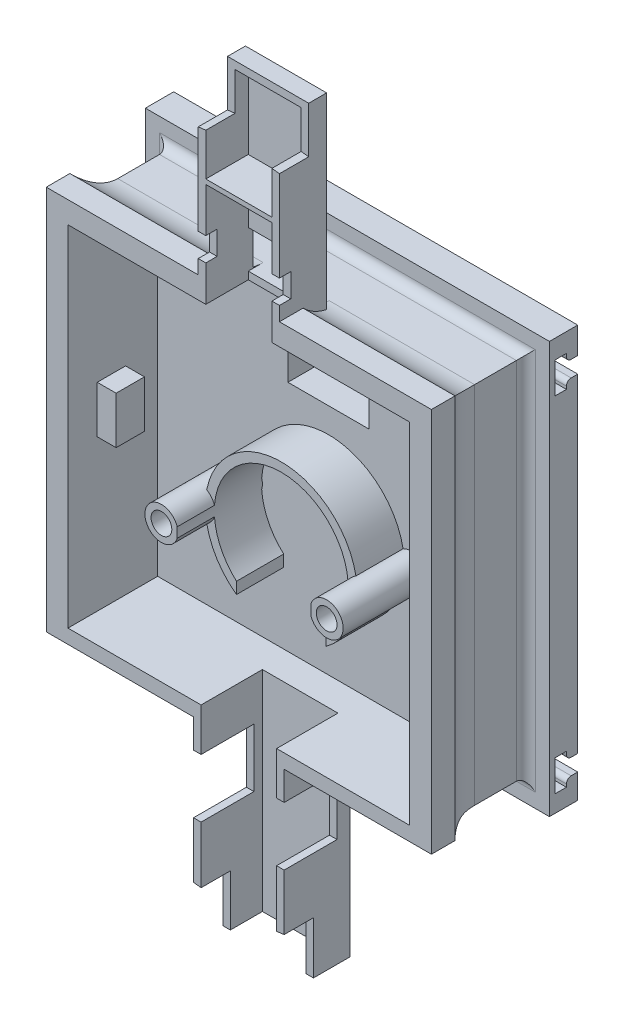
from build123d import *
from OCP.BRepAlgoAPI import BRepAlgoAPI_Cut
from OCP.TopTools import TopTools_ListOfShape
from build123d.topology import SkipClean

# Parameters (mm, degrees)
BOSS_EXTRUDE2_DEPTH      = 23
BOSS_EXTRUDE2_2_DEPTH    = 23
BOSS_EXTRUDE2_3_DEPTH    = 23
BOSS_EXTRUDE2_4_DEPTH    = 23
SKETCH2_W                = 72.4
SKETCH2_H                = 1
BOSS_EXTRUDE3_DEPTH      = 77.2
SKETCH1_5_W              = 14
SKETCH1_5_H              = 1.6
BOSS_EXTRUDE4_DEPTH      = 10
BOSS_EXTRUDE5_DEPTH      = 5
SKETCH5_W                = 1.6
SKETCH5_H                = 41.6
BOSS_EXTRUDE6_DEPTH      = 1
SKETCH5_5_W              = 1.6
SKETCH5_5_H              = 41.6
BOSS_EXTRUDE7_DEPTH      = 10
SKETCH6_W                = 17.2
SKETCH6_H                = 1
BOSS_EXTRUDE8_DEPTH      = 39
SKETCH7_W                = 17.2
SKETCH7_H                = 1.6
BOSS_EXTRUDE9_DEPTH      = 13
BOSS_EXTRUDE10_DEPTH     = 10
BOSS_EXTRUDE11_DEPTH     = 42.8
SKETCH1_12_W             = 1.6
SKETCH1_12_H             = 10
BOSS_EXTRUDE18_DEPTH     = 23
SKETCH10_W               = 72.4
SKETCH10_H               = 74
SKETCH10_R               = 3.5
BOSS_EXTRUDE14_DEPTH     = 3
BOSS_EXTRUDE15_DEPTH     = 13
SKETCH1_11_W             = 1.6
SKETCH1_11_H             = 10
BOSS_EXTRUDE17_DEPTH     = 23
FILLET1_START            = -1.6
FILLET1_DEPTH            = 29.2
FILLET1_START_2          = 44.8
FILLET1_2_DEPTH          = 29.2
FILLET1_START_3          = 26.6
FILLET1_3_DEPTH          = 2.6
FILLET1_START_4          = 43.2
FILLET1_4_DEPTH          = 2.6
FILLET1_START_5          = -2.995710024
FILLET1_5_DEPTH          = 81.600000768
FILLET1_START_6          = 74
FILLET1_6_DEPTH          = 4
FILLET1_START_7          = -6
FILLET1_7_DEPTH          = 4.4
SKICA1_W                 = 85.6
SKICA1_H                 = 87.2
P_IDAT_VYSUNUT_M1_DEPTH  = 6
ZAOBLIT1_R               = 2
ODEBRAT_VYSUNUT_M1_DEPTH = 90
ZAOBLIT2_R               = 1
SKICA3_W                 = 17.2
SKICA3_H                 = 17.2
ODEBRAT_VYSUNUT_M2_DEPTH = 90
SKETCH13_W               = 17.2
SKETCH13_H               = 3
CUT_EXTRUDE1_DEPTH       = 10
SKETCH14_W               = 14
SKETCH14_H               = 4
BOSS_EXTRUDE19_DEPTH     = 1.6
SKETCH16_W               = 8
SKETCH16_H               = 8
CUT_EXTRUDE3_DEPTH       = 1
SKETCH16_3_W             = 14
SKETCH16_3_H             = 1
BOSS_EXTRUDE20_DEPTH     = 9
SKETCH17_W               = 11.2
SKETCH17_H               = 12.4
CUT_EXTRUDE4_DEPTH       = 200
SKETCH18_R               = 85.15
SKETCH18_R_2             = 70.15
CUT_EXTRUDE5_DEPTH       = 6.2
BOSS_EXTRUDE25_OUTLINE_R = 2.2
BOSS_EXTRUDE25_DEPTH     = 20.9
SKETCH28_W               = 6
SKETCH28_H               = 10
BOSS_EXTRUDE28_DEPTH     = 4
SKETCH31_W               = 6
SKETCH31_H               = 10
BOSS_EXTRUDE29_DEPTH     = 4
CUT_EXTRUDE6_START       = -5
SKETCH10_14_R            = 2.2
CUT_EXTRUDE6_DEPTH       = 5
SKETCH38_W               = 17.2
SKETCH38_H               = 5
CUT_EXTRUDE7_DEPTH       = 2.4


with BuildPart() as part:
    # Sketch1 → Boss-Extrude2 (new body)
    with BuildSketch(Plane.XY):
        Polygon((28.2, 0), (0, 0), (0, 32), (-1.6, 32), (-1.6, -1.6), (28.2, -1.6), align=None)
    extrude(amount=BOSS_EXTRUDE2_DEPTH)



with BuildPart() as body_2:
    # Sketch1 → Boss-Extrude2 2 (new body)
    with BuildSketch(Plane.XY):
        Polygon((-1.6, 42), (0, 42), (0, 74), (29.2, 74), (29.2, 75.6), (-1.6, 75.6), align=None)
    extrude(amount=BOSS_EXTRUDE2_2_DEPTH)


with BuildPart() as body_3:
    # Sketch1 → Boss-Extrude2 3 (new body)
    with BuildSketch(Plane.XY):
        Polygon((72.4, 0), (44.2, 0), (44.2, -1.6), (74, -1.6), (74, 32), (72.4, 32), align=None)
    extrude(amount=BOSS_EXTRUDE2_3_DEPTH)


with BuildPart() as body_4:
    # Sketch1 → Boss-Extrude2 4 (new body)
    with BuildSketch(Plane.XY):
        Polygon((43.2, 75.6), (43.2, 74), (72.4, 74), (72.4, 42), (74, 42), (74, 75.6), align=None)
    extrude(amount=BOSS_EXTRUDE2_4_DEPTH)


with BuildPart() as part_1:
    add(part.part)

    add(body_2.part)  # Boss-Extrude3 merges body 2

    add(body_3.part)  # Boss-Extrude3 merges body 3

    add(body_4.part)  # Boss-Extrude3 merges body 4
    # Sketch2 → Boss-Extrude3 (add)
    with BuildSketch(Plane(origin=(0, -1.6, 0), x_dir=(1, 0, 0), z_dir=(0, 1, 0))):
        with Locations((36.2, -0.5)):
            Rectangle(SKETCH2_W, SKETCH2_H)
    extrude(amount=BOSS_EXTRUDE3_DEPTH)

    # Sketch1<5> → Boss-Extrude4 (add)
    with BuildSketch(Plane.XY):
        with Locations((36.2, 74.8)):
            Rectangle(SKETCH1_5_W, SKETCH1_5_H)
        with Locations((36.2, 74.8)):
            Rectangle(SKETCH1_5_W, SKETCH1_5_H)
    extrude(amount=BOSS_EXTRUDE4_DEPTH)

    # Sketch4 → Boss-Extrude5 (add)
    with BuildSketch(Plane.XY.offset(23)):
        Polygon((29.2, 78.604290744), (-4.6, 78.604290744), (-4.6, -2.995709256), (28.2, -2.995709256), (28.2, -1.6), (-1.6, -1.6), (-1.6, 75.6), (29.2, 75.6), align=None)
        Polygon((77, 78.604290744), (43.2, 78.604290744), (43.2, 75.6), (74, 75.6), (74, -1.6), (44.197854628, -1.6), (44.197854628, -2.995709256), (77, -2.995709256), align=None)
    extrude(amount=-BOSS_EXTRUDE5_DEPTH)

    # Sketch5 → Boss-Extrude6 (add)
    with BuildSketch(Plane.XY.offset(23)):
        with Locations((44, 94.8)):
            Rectangle(SKETCH5_W, SKETCH5_H)
        with Locations((28.4, 94.8)):
            Rectangle(SKETCH5_W, SKETCH5_H)
    extrude(amount=-BOSS_EXTRUDE6_DEPTH)

    # Sketch5<5> → Boss-Extrude7 (add)
    with BuildSketch(Plane.XY.offset(23)):
        with Locations((44, 94.8)):
            Rectangle(SKETCH5_5_W, SKETCH5_5_H)
        with Locations((28.4, 94.8)):
            Rectangle(SKETCH5_5_W, SKETCH5_5_H)
    extrude(amount=-BOSS_EXTRUDE7_DEPTH)

    # Sketch6 → Boss-Extrude8 (add)
    with BuildSketch(Plane(origin=(0, 75.6, 0), x_dir=(1, 0, 0), z_dir=(0, 1, 0))):
        with Locations((36.2, -13.5)):
            Rectangle(SKETCH6_W, SKETCH6_H)
    extrude(amount=BOSS_EXTRUDE8_DEPTH)

    # Sketch7 → Boss-Extrude9 (add)
    with BuildSketch(Plane.XY.offset(10)):
        with Locations((36.2, 114.8)):
            Rectangle(SKETCH7_W, SKETCH7_H)
    extrude(amount=BOSS_EXTRUDE9_DEPTH)

    # Sketch1<9> → Boss-Extrude10 (add)
    with BuildSketch(Plane.XY):
        Polygon((36.201957308, 0), (28.2, 0), (28.2, -1.6), (36.201276505, -1.6), align=None)
        Polygon((44.2, 0), (36.201957308, 0), (36.201276505, -1.6), (44.2, -1.6), align=None)
    extrude(amount=BOSS_EXTRUDE10_DEPTH)

    # Sketch8 → Boss-Extrude11 (add)
    with BuildSketch(Plane.XZ.offset(1.6)):
        Polygon((28.2, 23), (26.6, 23), (26.6, 9.1), (45.8, 9.1), (45.8, 23), (44.2, 23), (44.2, 10), (28.2, 10), align=None)
    extrude(amount=BOSS_EXTRUDE11_DEPTH)

    # Sketch1<12> → Boss-Extrude18 (add)
    with BuildSketch(Plane.XY):
        Polygon((-1.6, 32), (0, 32), (0, 42), (-0.266113958, 42), (-1.6, 42), align=None)
        with Locations((73.2, 37)):
            Rectangle(SKETCH1_12_W, SKETCH1_12_H)
    extrude(amount=BOSS_EXTRUDE18_DEPTH)

    # Sketch10 → Boss-Extrude14 (add)
    with BuildSketch(Plane.XY.offset(1)):
        with Locations((36.2, 37)):
            Rectangle(SKETCH10_W, SKETCH10_H)
        with BuildLine():
            Line((46.6, 15.70975997), (46.6, 18.331494428))
            ThreePointArc((46.6, 18.331494428), (49.214724455, 22.320480006), (50.361142857, 26.950222414))
            ThreePointArc((50.361142857, 26.950222414), (56.410242637, 30.214629731), (52.006, 24.937262009))
            ThreePointArc((52.006, 24.937262009), (50.091555257, 19.861530087), (46.6, 15.70975997))
        make_face(mode=Mode.SUBTRACT)
        with Locations(Location((18.7, 28, 0), (0, 0, 180))):
            Circle(SKETCH10_R, mode=Mode.SUBTRACT)
    extrude(amount=BOSS_EXTRUDE14_DEPTH)

    # Sketch10<5> → Boss-Extrude15 (add)
    with BuildSketch(Plane.XY.offset(1)):
        with BuildLine():
            ThreePointArc((52.006, 31.062737991), (36.2, 44.1), (20.394, 31.062737991))
            ThreePointArc((20.394, 31.062737991), (21.410242637, 30.214629731), (22.038857143, 29.049777586))
            ThreePointArc((22.038857143, 29.049777586), (36.2, 42.2), (50.361142857, 29.049777586))
            ThreePointArc((50.361142857, 29.049777586), (50.989757363, 30.214629731), (52.006, 31.062737991))
        make_face()
        with BuildLine():
            ThreePointArc((20.394, 24.937262009), (22.308444743, 19.861530087), (25.8, 15.70975997))
            Line((25.8, 15.70975997), (25.8, 18.331494428))
            ThreePointArc((25.8, 18.331494428), (23.185275545, 22.320480006), (22.038857143, 26.950222414))
            ThreePointArc((22.038857143, 26.950222414), (21.410242637, 25.785370269), (20.394, 24.937262009))
        make_face()
        with BuildLine():
            Line((46.6, 18.331494428), (46.6, 15.70975997))
            ThreePointArc((46.6, 15.70975997), (50.091555257, 19.861530087), (52.006, 24.937262009))
            ThreePointArc((52.006, 24.937262009), (50.989757363, 25.785370269), (50.361142857, 26.950222414))
            ThreePointArc((50.361142857, 26.950222414), (49.214724455, 22.320480006), (46.6, 18.331494428))
        make_face()
        with BuildLine():
            ThreePointArc((25.8, 15.70975997), (26.243700768, 15.347644267), (26.7, 15.001538553))
            Line((26.7, 15.001538553), (26.7, 17.445853895))
            ThreePointArc((26.7, 17.445853895), (26.240151116, 17.878665591), (25.8, 18.331494428))
            Line((25.8, 18.331494428), (25.8, 15.70975997))
        make_face()
        with BuildLine():
            Line((45.7, 17.445853895), (45.7, 15.001538553))
            ThreePointArc((45.7, 15.001538553), (46.156299232, 15.347644267), (46.6, 15.70975997))
            Line((46.6, 15.70975997), (46.6, 18.331494428))
            ThreePointArc((46.6, 18.331494428), (46.159848884, 17.878665591), (45.7, 17.445853895))
        make_face()
        with BuildLine():
            ThreePointArc((20.182285714, 26.374321969), (20.27192783, 25.653403117), (20.394, 24.937262009))
            ThreePointArc((20.394, 24.937262009), (21.410242637, 25.785370269), (22.038857143, 26.950222414))
            ThreePointArc((22.038857143, 26.950222414), (22, 28), (22.038857143, 29.049777586))
            ThreePointArc((22.038857143, 29.049777586), (21.410242637, 30.214629731), (20.394, 31.062737991))
            ThreePointArc((20.394, 31.062737991), (20.27192783, 30.346596883), (20.182285714, 29.625678031))
            ThreePointArc((20.182285714, 29.625678031), (20.712588951, 28.888530086), (20.9, 28))
            ThreePointArc((20.9, 28), (20.712588951, 27.111469914), (20.182285714, 26.374321969))
        make_face()
        with BuildLine():
            ThreePointArc((50.361142857, 26.950222414), (50.989757363, 25.785370269), (52.006, 24.937262009))
            ThreePointArc((52.006, 24.937262009), (52.12807217, 25.653403117), (52.217714286, 26.374321969))
            ThreePointArc((52.217714286, 26.374321969), (51.5, 28), (52.217714286, 29.625678031))
            ThreePointArc((52.217714286, 29.625678031), (52.12807217, 30.346596883), (52.006, 31.062737991))
            ThreePointArc((52.006, 31.062737991), (50.989757363, 30.214629731), (50.361142857, 29.049777586))
            ThreePointArc((50.361142857, 29.049777586), (50.4, 28), (50.361142857, 26.950222414))
        make_face()
    extrude(amount=BOSS_EXTRUDE15_DEPTH)

    # Sketch1<11> → Boss-Extrude17 (add)
    with BuildSketch(Plane.XY):
        Polygon((-1.6, 32), (0, 32), (0, 42), (-0.266113958, 42), (-1.6, 42), align=None)
        with Locations((73.2, 37)):
            Rectangle(SKETCH1_11_W, SKETCH1_11_H)
    extrude(amount=BOSS_EXTRUDE17_DEPTH)


with BuildPart() as fillet1_tool:
    # Fillet1: read off the stored shape, not the designer's step
    # Fillet1 outline → Fillet1 (new body)
    with BuildSketch(Plane.YZ.offset(FILLET1_START)):
        with BuildLine():
            Line((-1.6, 12.904297811), (-1.6, 18))
            Line((-1.6, 18), (-2.995709296, 18.000000067))
            ThreePointArc((-2.995709296, 18.000000067), (-1.95523699, 15.545991677), (-1.6, 12.904297811))
        make_face()
        with BuildLine():
            ThreePointArc((75.6, 10.854368327), (76.381619107, 14.730120347), (78.604290744, 18))
            Line((78.604290744, 18), (75.6, 18))
            Line((75.6, 18), (75.6, 10.854368327))
        make_face()
    extrude(amount=FILLET1_DEPTH)


with BuildPart() as part_2:
    add(part_1.part)


with BuildPart() as part_3:
    # Fillet1: joined with fillet1_tool
    add(part_2.part.fuse(fillet1_tool.part, tol=0.00001))


with BuildPart() as fillet1_2_tool:
    # Fillet1 2 outline → Fillet1 2 (new body)
    with BuildSketch(Plane.YZ.offset(FILLET1_START_2)):
        with BuildLine():
            Line((-1.6, 12.904297811), (-1.6, 18))
            Line((-1.6, 18), (-2.995709296, 18.000000067))
            ThreePointArc((-2.995709296, 18.000000067), (-1.95523699, 15.545991677), (-1.6, 12.904297811))
        make_face()
        with BuildLine():
            ThreePointArc((75.6, 10.854368327), (76.381619107, 14.730120347), (78.604290744, 18))
            Line((78.604290744, 18), (75.6, 18))
            Line((75.6, 18), (75.6, 10.854368327))
        make_face()
    extrude(amount=FILLET1_2_DEPTH)


with BuildPart() as part_4:
    add(part_3.part)


with BuildPart() as part_5:
    # Fillet1 2: joined with fillet1_2_tool
    add(part_4.part.fuse(fillet1_2_tool.part, tol=0.00001))


with BuildPart() as fillet1_3_tool:
    # Fillet1 3 outline → Fillet1 3 (new body)
    with BuildSketch(Plane.YZ.offset(FILLET1_START_3)):
        with BuildLine():
            ThreePointArc((75.6, 10.854368327), (76.381619107, 14.730120347), (78.604290744, 18))
            Line((78.604290744, 18), (75.6, 18))
            Line((75.6, 18), (75.6, 10.854368327))
        make_face()
    extrude(amount=FILLET1_3_DEPTH)


with BuildPart() as part_6:
    add(part_5.part)


with BuildPart() as part_7:
    # Fillet1 3: joined with fillet1_3_tool
    add(part_6.part.fuse(fillet1_3_tool.part, tol=0.00001))


with BuildPart() as fillet1_4_tool:
    # Fillet1 4 outline → Fillet1 4 (new body)
    with BuildSketch(Plane.YZ.offset(FILLET1_START_4)):
        with BuildLine():
            ThreePointArc((75.6, 10.854368327), (76.381619107, 14.730120347), (78.604290744, 18))
            Line((78.604290744, 18), (75.6, 18))
            Line((75.6, 18), (75.6, 10.854368327))
        make_face()
    extrude(amount=FILLET1_4_DEPTH)


with BuildPart() as part_8:
    add(part_7.part)


with BuildPart() as part_9:
    # Fillet1 4: joined with fillet1_4_tool
    add(part_8.part.fuse(fillet1_4_tool.part, tol=0.00001))


with BuildPart() as fillet1_5_tool:
    # Fillet1 5 outline → Fillet1 5 (new body)
    with BuildSketch(Plane(origin=(0, 0, 0), x_dir=(1, 0, 0), z_dir=(0, 1, 0)).offset(FILLET1_START_5)):
        with BuildLine():
            Line((-1.6, -18.000000067), (-1.6, -10.858571571))
            ThreePointArc((-1.6, -10.858571571), (-2.380455543, -14.731554917), (-4.6, -18))
            Line((-4.6, -18), (-1.6, -18.000000067))
        make_face()
        with BuildLine():
            Line((74, -18), (77.000000696, -18.000000682))
            ThreePointArc((77.000000696, -18.000000682), (74.780455731, -14.731555367), (74, -10.858571571))
            Line((74, -10.858571571), (74, -18))
        make_face()
    extrude(amount=FILLET1_5_DEPTH)


with BuildPart() as part_10:
    add(part_9.part)


with BuildPart() as part_11:
    # Fillet1 5: joined with fillet1_5_tool
    add(part_10.part.fuse(fillet1_5_tool.part, tol=0.00001))


with BuildPart() as fillet1_6_tool:
    # Fillet1 6 outline → Fillet1 6 (new body)
    with BuildSketch(Plane.YZ.offset(FILLET1_START_6)):
        with BuildLine():
            ThreePointArc((78.604290744, 18), (76.382433847, 14.732057617), (75.600000883, 10.858571571))
            Line((75.600000883, 10.858571571), (78.604290744, 10.858571571))
            Line((78.604290744, 10.858571571), (78.604290744, 18))
        make_face()
        with BuildLine():
            Line((-2.995709296, 18.000000067), (-2.995710024, 10.858571571))
            Line((-2.995710024, 10.858571571), (-1.6, 10.858571571))
            Line((-1.6, 10.858571571), (-1.6, 12.904297811))
            ThreePointArc((-1.6, 12.904297811), (-1.95523699, 15.545991677), (-2.995709296, 18.000000067))
        make_face()
    extrude(amount=FILLET1_6_DEPTH)


with BuildPart() as part_12:
    add(part_11.part)

    # Fillet1 6: cut by fillet1_6_tool, with a tolerance
    fillet1_6_stock = TopTools_ListOfShape()
    fillet1_6_stock.Append(part_12.part.wrapped)
    fillet1_6_tools = TopTools_ListOfShape()
    fillet1_6_tools.Append(fillet1_6_tool.part.wrapped)
    fillet1_6_cut = BRepAlgoAPI_Cut()
    fillet1_6_cut.SetArguments(fillet1_6_stock)
    fillet1_6_cut.SetTools(fillet1_6_tools)
    fillet1_6_cut.SetFuzzyValue(0.00001)
    fillet1_6_cut.Build()
    add(Compound.cast(fillet1_6_cut.Shape()).solids(), mode=Mode.REPLACE)


with BuildPart() as fillet1_7_tool:
    # Fillet1 7 outline → Fillet1 7 (new body)
    with BuildSketch(Plane.YZ.offset(FILLET1_START_7)):
        with BuildLine():
            ThreePointArc((78.604290744, 18), (76.382433847, 14.732057617), (75.600000883, 10.858571571))
            Line((75.600000883, 10.858571571), (78.604290744, 10.858571571))
            Line((78.604290744, 10.858571571), (78.604290744, 18))
        make_face()
        with BuildLine():
            Line((-2.995709296, 18.000000067), (-2.995710024, 10.858571571))
            Line((-2.995710024, 10.858571571), (-1.6, 10.858571571))
            Line((-1.6, 10.858571571), (-1.6, 12.904297811))
            ThreePointArc((-1.6, 12.904297811), (-1.95523699, 15.545991677), (-2.995709296, 18.000000067))
        make_face()
    extrude(amount=FILLET1_7_DEPTH)


with BuildPart() as part_13:
    add(part_12.part)

    # Fillet1 7: cut by fillet1_7_tool, with a tolerance
    fillet1_7_stock = TopTools_ListOfShape()
    fillet1_7_stock.Append(part_13.part.wrapped)
    fillet1_7_tools = TopTools_ListOfShape()
    fillet1_7_tools.Append(fillet1_7_tool.part.wrapped)
    fillet1_7_cut = BRepAlgoAPI_Cut()
    fillet1_7_cut.SetArguments(fillet1_7_stock)
    fillet1_7_cut.SetTools(fillet1_7_tools)
    fillet1_7_cut.SetFuzzyValue(0.00001)
    fillet1_7_cut.Build()
    add(Compound.cast(fillet1_7_cut.Shape()).solids(), mode=Mode.REPLACE)

    # Skica1 → Přidat vysunutím1 (add)
    with BuildSketch(Plane(origin=(0, 0, 0), x_dir=(-1, 0, 0), z_dir=(0, 0, -1))):
        with Locations((-36.2, 37)):
            Rectangle(SKICA1_W, SKICA1_H)
    extrude(amount=P_IDAT_VYSUNUT_M1_DEPTH)

    # Zaoblit1
    zaoblit1_edges = [part_13.edges().sort_by_distance(p)[0] for p in [
        (36.2, -1.6, 0),
        (-1.6, 37, 0),
        (36.2, 75.6, 0),
        (74, 37, 0),
    ]]
    fillet(zaoblit1_edges, radius=ZAOBLIT1_R)

    # Skica2 → Odebrat vysunutím1 (cut)
    with BuildSketch(Plane.ZY.offset(6.6)):
        Polygon((-6, 2), (-3.6, 2), (-3.6, 3.6), (-1.2, 3.6), (-1.2, -3), (-3.6, -3), (-3.6, -1.4), (-6, -1.4), align=None)
        Polygon((-6, 75), (-6, 71.6), (-3.6, 71.6), (-3.6, 70), (-1.2, 70), (-1.2, 76.6), (-3.6, 76.6), (-3.6, 75), align=None)
    extrude(amount=-ODEBRAT_VYSUNUT_M1_DEPTH, mode=Mode.SUBTRACT)

    # Zaoblit2
    zaoblit2_edges = [part_13.edges().sort_by_distance(p)[0] for p in [
        (36.2, 75, -3.6),
        (36.2, 71.6, -3.6),
        (36.2, 2, -3.6),
        (36.2, -1.4, -3.6),
    ]]
    fillet(zaoblit2_edges, radius=ZAOBLIT2_R)

    # Skica3 → Odebrat vysunutím2 (cut)
    with BuildSketch(Plane(origin=(0, 0, -6), x_dir=(-1, 0, 0), z_dir=(0, 0, -1))):
        with Locations((-36.2, 58)):
            Rectangle(SKICA3_W, SKICA3_H)
    extrude(amount=-ODEBRAT_VYSUNUT_M2_DEPTH, mode=Mode.SUBTRACT)

    # Sketch13 → Cut-Extrude1 (cut)
    with BuildSketch(Plane(origin=(0, 115.6, 0), x_dir=(1, 0, 0), z_dir=(0, 1, 0))):
        with Locations((36.2, -11.5)):
            Rectangle(SKETCH13_W, SKETCH13_H)
    extrude(amount=-CUT_EXTRUDE1_DEPTH, mode=Mode.SUBTRACT)

    # Sketch14 → Boss-Extrude19 (add)
    with BuildSketch(Plane.XZ.offset(-74)):
        with Locations((36.2, 12)):
            Rectangle(SKETCH14_W, SKETCH14_H)
    extrude(amount=-BOSS_EXTRUDE19_DEPTH)

    # Sketch16 → Cut-Extrude3 (cut)
    with BuildSketch(Plane.XY.offset(14)):
        with Locations((33.2, 79.6)):
            Rectangle(SKETCH16_W, SKETCH16_H)
    extrude(amount=-CUT_EXTRUDE3_DEPTH, mode=Mode.SUBTRACT)

    # Sketch16<3> → Boss-Extrude20 (add)
    with BuildSketch(Plane.XY.offset(14)):
        with Locations((36.2, 96.5)):
            Rectangle(SKETCH16_3_W, SKETCH16_3_H)
    extrude(amount=BOSS_EXTRUDE20_DEPTH)

    # Sketch17 → Cut-Extrude4 (cut)
    with BuildSketch(Plane.ZY.offset(-26.6)):
        with Locations((17.4, -15.295709256)):
            Rectangle(SKETCH17_W, SKETCH17_H)
    extrude(amount=-CUT_EXTRUDE4_DEPTH, mode=Mode.SUBTRACT)

    # Sketch18 → Cut-Extrude5 (cut)
    with BuildSketch(Plane.XY.offset(23)):
        with Locations((36.2, 36.15)):
            Circle(SKETCH18_R)
        with Locations((36.2, 36.15)):
            Circle(SKETCH18_R_2, mode=Mode.SUBTRACT)
    extrude(amount=-CUT_EXTRUDE5_DEPTH, mode=Mode.SUBTRACT)

    # Boss-Extrude25: read off the stored shape, not the designer's step
    # Boss-Extrude25 outline → Boss-Extrude25 (add)
    # profile 1 of 2: a face of its own
    with SkipClean():  # the faces are left unmerged after this step: merging them gives an invalid solid
        with BuildSketch(Plane.XY.offset(1)):
            with BuildLine():
                ThreePointArc((22.038857143, 26.950222414), (22, 28), (22.038857143, 29.049777586))
                ThreePointArc((22.038857143, 29.049777586), (15.2, 28), (22.038857143, 26.950222414))
            make_face()
            with Locations((18.7, 28)):
                Circle(BOSS_EXTRUDE25_OUTLINE_R, mode=Mode.SUBTRACT)
        # profile 2 of 2: a face of its own
        with BuildSketch(Plane.XY.offset(1)):
            with BuildLine():
                ThreePointArc((50.361142857, 29.049777586), (50.4, 28), (50.361142857, 26.950222414))
                ThreePointArc((50.361142857, 26.950222414), (57.2, 28), (50.361142857, 29.049777586))
            make_face()
            with Locations((53.7, 28)):
                Circle(BOSS_EXTRUDE25_OUTLINE_R, mode=Mode.SUBTRACT)
        extrude(amount=BOSS_EXTRUDE25_DEPTH)

    # Sketch28 → Boss-Extrude28 (add)
    with SkipClean():  # the faces are left unmerged after this step: merging them gives an invalid solid
        with BuildSketch(Plane(origin=(0, 0, 0), x_dir=(0, 0, -1), z_dir=(1, 0, 0))):
            with Locations((-13.8, 37)):
                Rectangle(SKETCH28_W, SKETCH28_H)
        extrude(amount=BOSS_EXTRUDE28_DEPTH)

    # Sketch31 → Boss-Extrude29 (add)
    with SkipClean():  # the faces are left unmerged after this step: merging them gives an invalid solid
        with BuildSketch(Plane.ZY.offset(-72.4)):
            with Locations((13.8, 37)):
                Rectangle(SKETCH31_W, SKETCH31_H)
        extrude(amount=BOSS_EXTRUDE29_DEPTH)

    # Sketch10<14> → Cut-Extrude6 (cut)
    with SkipClean():  # the faces are left unmerged after this step: merging them gives an invalid solid
        with BuildSketch(Plane.XY.offset(1).offset(CUT_EXTRUDE6_START)):
            with Locations(Location((53.7, 28, 0), (0, 0, 180))):
                Circle(SKETCH10_14_R)
            with Locations(Location((18.7, 28, 0), (0, 0, 180))):
                Circle(SKETCH10_14_R)
        extrude(amount=CUT_EXTRUDE6_DEPTH, mode=Mode.SUBTRACT)

    # Sketch38 → Cut-Extrude7 (cut)
    with SkipClean():  # the faces are left unmerged after this step: merging them gives an invalid solid
        with BuildSketch(Plane.XY.offset(23)):
            with Locations((36.2, 84.104290744)):
                Rectangle(SKETCH38_W, SKETCH38_H)
        extrude(amount=-CUT_EXTRUDE7_DEPTH, mode=Mode.SUBTRACT)


solid = part_13.part
